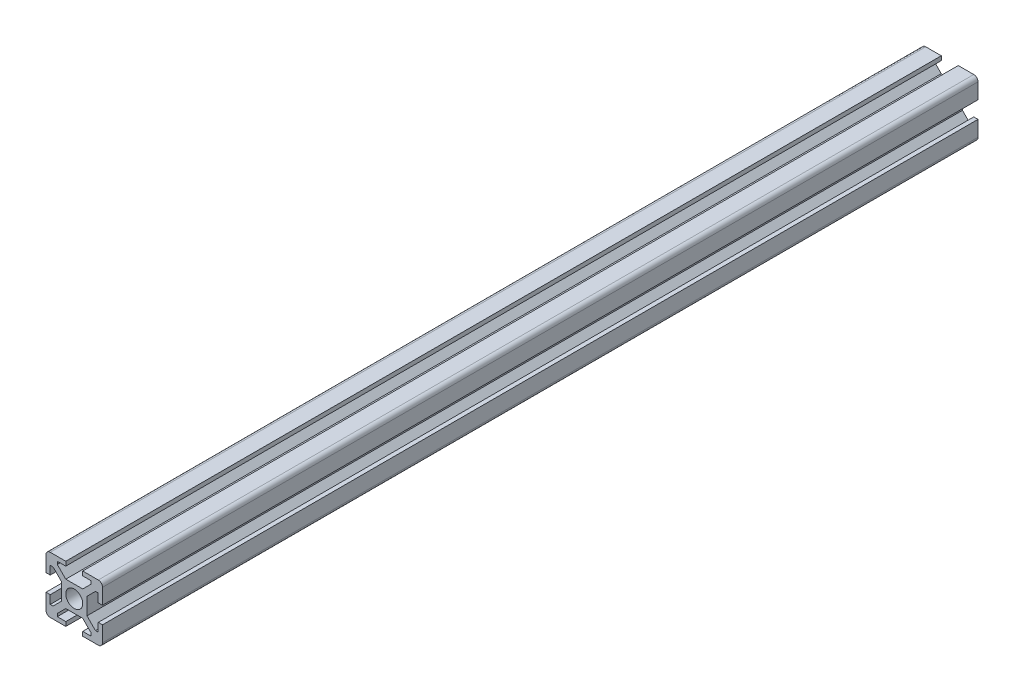
from build123d import *

# Parameters (mm, degrees)
ESQUISSE1_W                  = 20
ESQUISSE1_H                  = 20
EXTRUSION1_DEPTH             = 155
CONG_1_R                     = 1.5
ENL_V_MAT_EXTRU_1_DEPTH      = 311.322412984
R_P_TITION_CIRCULAIRE1_COUNT = 4


with BuildPart() as part:
    # Esquisse1 → Extrusion1 (new, symmetric)
    with BuildSketch(Plane.XY):
        Rectangle(ESQUISSE1_W, ESQUISSE1_H)
    extrude(amount=EXTRUSION1_DEPTH, both=True)

    # Congé1
    cong_1_edges = [part.edges().sort_by_distance(p)[0] for p in [
        (-10, -10, 0),
        (10, -10, 0),
        (-10, 10, 0),
        (10, 10, 0),
    ]]
    fillet(cong_1_edges, radius=CONG_1_R)

    # Esquisse2 → Enlèv. mat.-Extru.1 (cut, through all)
    with BuildSketch(Plane(origin=(0, 0, -155), x_dir=(-1, 0, 0), z_dir=(0, 0, -1))):
        Polygon((-10, 3), (-10, -3), (-8.5, -3), (-8.5, -6), (-7.5, -6), (-4.5, -3), (-4.5, 3), (-7.5, 6), (-8.5, 6), (-8.5, 3), align=None)
    enl_v_mat_extru_1 = extrude(amount=-ENL_V_MAT_EXTRU_1_DEPTH, mode=Mode.SUBTRACT)

    # Répétition circulaire1: Enlèv. mat.-Extru.1 ×4 about axis
    r_p_tition_circulaire1_axis = Axis((0, 0, 9.333809512), (0, 0, -1))
    for i in range(1, R_P_TITION_CIRCULAIRE1_COUNT):
        add(enl_v_mat_extru_1.rotate(r_p_tition_circulaire1_axis, i * 360 / R_P_TITION_CIRCULAIRE1_COUNT), mode=Mode.SUBTRACT)

    # Esquisse5 → Trou taraudé M6x1.01 (revolve, cut)
    with BuildSketch(Plane(origin=(0, 0, -155), x_dir=(0, 1, 0), z_dir=(1, 0, 0))):
        Polygon((0, 0), (0, 31.502151548), (2.5, 30), (2.5, 24), (3, 24), (3, 0), align=None)
    trou_taraud_m6x1_01 = revolve(axis=Axis((0, 0, -161.35), (0, 0, 1)), mode=Mode.SUBTRACT)

    # Symétrie1: Trou taraudé M6x1.01 across plane
    add(trou_taraud_m6x1_01.mirror(Plane.XY), mode=Mode.SUBTRACT)


solid = part.part
